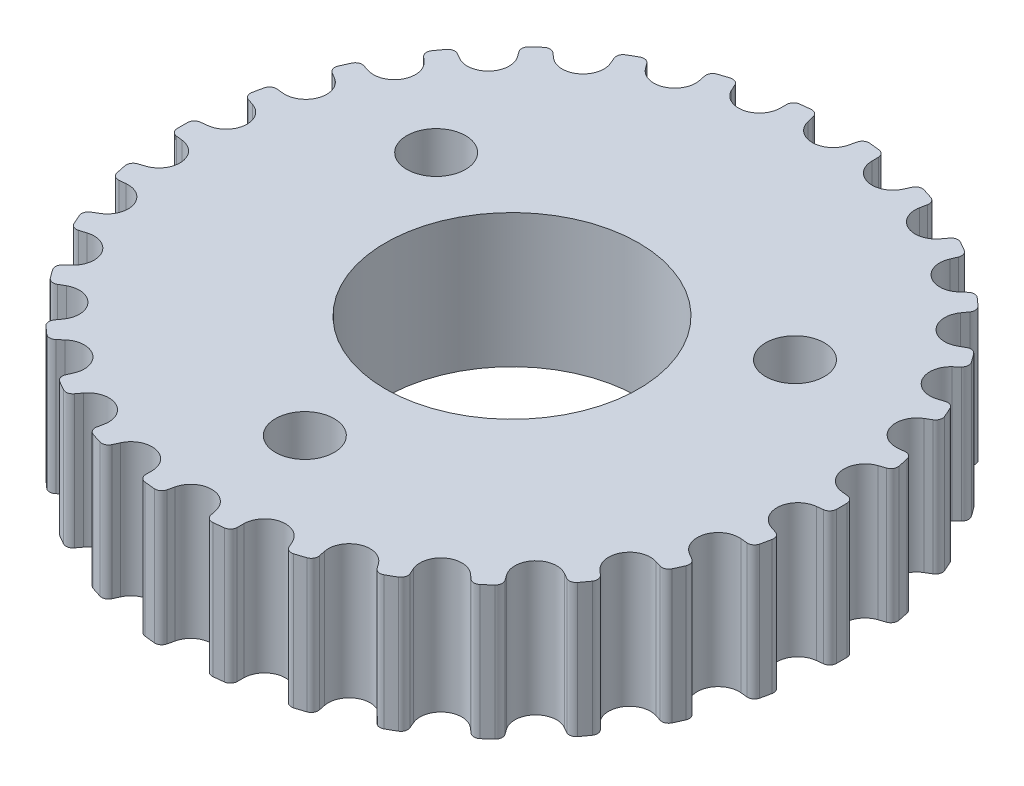
from build123d import *

# Parameters (mm, degrees)
SKETCH1_R           = 14.323944878
BOSS_EXTRUDE1_DEPTH = 5.8
CUT_EXTRUDE1_DEPTH  = 22.07108905
CIRPATTERN1_COUNT   = 30
SKETCH3_R           = 5.5
CUT_EXTRUDE2_DEPTH  = 22.033616305
SKETCH4_R           = 1.275
CUT_EXTRUDE3_DEPTH  = 22.033616305


with BuildPart() as part:
    # Sketch1 → Boss-Extrude1 (new body)
    with BuildSketch(Plane(origin=(0, 0, 0), x_dir=(1, 0, 0), z_dir=(0, 1, 0))):
        Circle(SKETCH1_R)
    extrude(amount=BOSS_EXTRUDE1_DEPTH)

    # Sketch2 → Cut-Extrude1 (cut, through all)
    with BuildSketch(Plane(origin=(0, 5.8, 0), x_dir=(1, 0, 0), z_dir=(0, 1, 0))):
        with BuildLine():
            Line((-0.88830444, 13.756422166), (-0.95, 14.033881093))
            ThreePointArc((-0.95, 14.033881093), (-1.065709647, 14.210883809), (-1.269434594, 14.267583281))
            ThreePointArc((-1.269434594, 14.267583281), (-2.127648488, 14.165045315), (-2.978115599, 14.010932316))
            Line((-2.978115599, 14.010932316), (-2.978115599, 14.323944878))
            Line((-2.978115599, 14.323944878), (2.978115599, 14.323944878))
            Line((2.978115599, 14.323944878), (2.978115599, 14.010932316))
            ThreePointArc((2.978115599, 14.010932316), (2.127648488, 14.165045315), (1.269434594, 14.267583281))
            ThreePointArc((1.269434594, 14.267583281), (1.065709647, 14.210883809), (0.95, 14.033881093))
            Line((0.95, 14.033881093), (0.88830444, 13.756422166))
            ThreePointArc((0.88830444, 13.756422166), (0, 13.043944878), (-0.88830444, 13.756422166))
        make_face()
    cut_extrude1 = extrude(amount=-CUT_EXTRUDE1_DEPTH, mode=Mode.SUBTRACT)

    # CirPattern1: Cut-Extrude1 ×30 about axis
    cirpattern1_axis = Axis((0, 5.8, 0), (0, -1, 0))
    for i in range(1, CIRPATTERN1_COUNT):
        add(cut_extrude1.rotate(cirpattern1_axis, i * 360 / CIRPATTERN1_COUNT), mode=Mode.SUBTRACT)

    # Sketch3 → Cut-Extrude2 (cut, through all)
    with BuildSketch(Plane.XZ):
        Circle(SKETCH3_R)
    extrude(amount=-CUT_EXTRUDE2_DEPTH, mode=Mode.SUBTRACT)

    # Sketch4 → Cut-Extrude3 (cut, through all)
    with BuildSketch(Plane.XZ):
        with Locations((0, 9)):
            Circle(SKETCH4_R)
        with Locations((7.794228634, -4.5)):
            Circle(SKETCH4_R)
        with Locations((-7.794228634, -4.5)):
            Circle(SKETCH4_R)
    extrude(amount=-CUT_EXTRUDE3_DEPTH, mode=Mode.SUBTRACT)


solid = part.part
